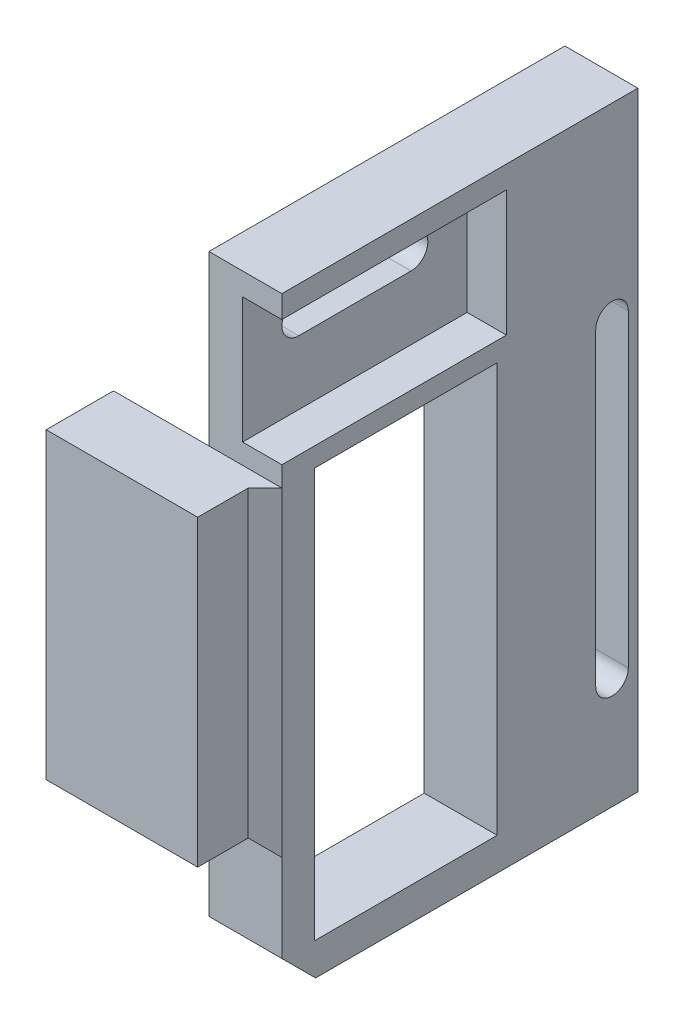
from build123d import *

# Parameters (mm, degrees)
SKETCH_1_W               = 27.1
SKETCH_1_H               = 42.3
SKETCH_1_W_2             = 21.1
SKETCH_1_H_2             = 36.3
EXTRUDE_1_DEPTH          = 6.5
CHAMFER_1_SIZE           = 3
EXTRUDE_2_DEPTH          = 8.7
EXTRUDE_2_DEPTH_BACK     = 6.5
SKETCH_2_W               = 5
SKETCH_2_H               = 24.3
SKETCH_2_R               = 1.475
SKETCH_3_W               = 27.1
SKETCH_3_H               = 15
EXTRUDE_3_DEPTH          = 6.5
SKETCH_4_W               = 17.60784849
SKETCH_4_H               = 15
EXTRUDE_4_DEPTH          = 6.5
SKETCH_5_W               = 20
SKETCH_5_H               = 11
SKETCH_5_W_2             = 5
SKETCH_5_H_2             = 36.3
EXTRUDE_5_DEPTH          = 6.5
CUT_EXTRUDE_5_DEPTH      = 47.31872216
CUT_EXTRUDE_5_DEPTH_BACK = 47.31872216
SKETCH_6_W               = 20
SKETCH_6_H               = 11.2
CUT_EXTRUDE_6_DEPTH      = 48.966384297
CUT_EXTRUDE_6_DEPTH_BACK = 48.966384297
SKETCH_9_W               = 5
SKETCH_9_H               = 24.3
SKETCH_10_W              = 20
SKETCH_10_H              = 11.2
EXTRUDE_6_DEPTH          = 3
CUT_EXTRUDE_7_DEPTH      = 46.956327339
CUT_EXTRUDE_7_DEPTH_BACK = 46.956327339
SKETCH_11_W              = 13
SKETCH_11_H              = 15
EXTRUDE_7_DEPTH          = 8.5
EXTRUDE_7_DEPTH_BACK     = 5
SKETCH_13_W              = 6
SKETCH_13_H              = 27
CHAMFER_2_SIZE           = 1.5
SKETCH_14_W              = 16.26
SKETCH_14_H              = 36.46
SKETCH_14_W_2            = 16.1
SKETCH_14_H_2            = 36.3
CUT_EXTRUDE_8_DEPTH      = 40.412878606
SKETCH_15_W              = 7.60784849
SKETCH_15_H              = 39.3
EXTRUDE_8_DEPTH          = 6
CUT_EXTRUDE_9_DEPTH      = 6
EXTRUDE_9_DEPTH          = 0.5
CUT_EXTRUDE_10_DEPTH     = 40.412878606
CUT_EXTRUDE_11_DEPTH     = 10


with BuildPart() as part:
    # 草图1 → 凸台-拉伸1 (new body)
    with BuildSketch(Plane(origin=(0, 0, 0), x_dir=(0, 0, -1), z_dir=(1, 0, 0))):
        Rectangle(SKETCH_1_W, SKETCH_1_H)
        Rectangle(SKETCH_1_W_2, SKETCH_1_H_2, mode=Mode.SUBTRACT)
    extrude(amount=EXTRUDE_1_DEPTH)

    # 倒角1
    chamfer_1_edges = [part.edges().sort_by_distance(p)[0] for p in [
        (3.25, 21.15, 13.55),
        (3.25, 21.15, -13.55),
        (3.25, -21.15, -13.55),
        (3.25, -21.15, 13.55),
    ]]
    chamfer(chamfer_1_edges, length=CHAMFER_1_SIZE)

    # 草图2 → 凸台-拉伸2 (add, two sides: drawn at the far end of the back side and taken through both)
    with BuildSketch(Plane.ZY.offset(-EXTRUDE_2_DEPTH_BACK)):
        with Locations((16.05, 0)):
            Rectangle(SKETCH_2_W, SKETCH_2_H)
        with Locations((16.05, 7.15)):
            Circle(SKETCH_2_R, mode=Mode.SUBTRACT)
        with Locations((16.05, -7.15)):
            Circle(SKETCH_2_R, mode=Mode.SUBTRACT)
    extrude(amount=EXTRUDE_2_DEPTH + EXTRUDE_2_DEPTH_BACK)

    # 草图3 → 凸台-拉伸3 (add)
    with BuildSketch(Plane(origin=(6.5, 0, 0), x_dir=(0, 0, -1), z_dir=(1, 0, 0))):
        with Locations((0, 25.65)):
            Rectangle(SKETCH_3_W, SKETCH_3_H)
    extrude(amount=-EXTRUDE_3_DEPTH)

    # 草图4 → 凸台-拉伸4 (add)
    with BuildSketch(Plane.ZY):
        with Locations((-22.353924245, 25.65)):
            Rectangle(SKETCH_4_W, SKETCH_4_H)
    extrude(amount=-EXTRUDE_4_DEPTH)

    # 草图5 → 凸台-拉伸5 (add)
    with BuildSketch(Plane.ZY):
        with Locations((3.55, 25.714062057)):
            Rectangle(SKETCH_5_W, SKETCH_5_H)
        with Locations((-8.05, 0)):
            Rectangle(SKETCH_5_W_2, SKETCH_5_H_2)
    extrude(amount=-EXTRUDE_5_DEPTH)

    # 草图6 → 切除-拉伸5 (cut, two sides: drawn at the far end of the back side and taken through both)
    with BuildSketch(Plane.ZY.offset(-CUT_EXTRUDE_5_DEPTH_BACK)):
        with Locations((3.55, 25.55)):
            Rectangle(SKETCH_6_W, SKETCH_6_H)
    extrude(amount=CUT_EXTRUDE_5_DEPTH + CUT_EXTRUDE_5_DEPTH_BACK, mode=Mode.SUBTRACT)

    # 草图9 → 切除-拉伸6 (cut, two sides: drawn at the far end of the back side and taken through both)
    with BuildSketch(Plane.ZY.offset(8.7).offset(-CUT_EXTRUDE_6_DEPTH_BACK)):
        with Locations((16.05, 0)):
            Rectangle(SKETCH_9_W, SKETCH_9_H)
    extrude(amount=CUT_EXTRUDE_6_DEPTH + CUT_EXTRUDE_6_DEPTH_BACK, mode=Mode.SUBTRACT)

    # 草图10 → 凸台-拉伸6 (add)
    with BuildSketch(Plane.ZY):
        with Locations((3.55, 25.55)):
            Rectangle(SKETCH_10_W, SKETCH_10_H)
    extrude(amount=-EXTRUDE_6_DEPTH)

    # 草图11 → 切除-拉伸7 (cut, two sides: drawn at the far end of the back side and taken through both)
    with BuildSketch(Plane(origin=(6.5, 0, 0), x_dir=(0, 0, -1), z_dir=(1, 0, 0)).offset(-CUT_EXTRUDE_7_DEPTH_BACK)):
        with Locations((24.65784849, 25.65)):
            Rectangle(SKETCH_11_W, SKETCH_11_H)
    extrude(amount=CUT_EXTRUDE_7_DEPTH + CUT_EXTRUDE_7_DEPTH_BACK, mode=Mode.SUBTRACT)

    # 草图13 → 凸台-拉伸7 (add, two sides: drawn at the far end of the back side and taken through both)
    with BuildSketch(Plane.ZY.offset(-EXTRUDE_7_DEPTH_BACK)):
        with Locations((16.55, 4.65)):
            Rectangle(SKETCH_13_W, SKETCH_13_H)
    extrude(amount=EXTRUDE_7_DEPTH + EXTRUDE_7_DEPTH_BACK)

    # 倒角2
    chamfer_2_edges = [part.edges().sort_by_distance(p)[0] for p in [
        (5, 4.65, 13.55),
        (2.5, -8.85, 13.55),
    ]]
    chamfer(chamfer_2_edges, length=CHAMFER_2_SIZE - 0.0001)  # a hair under: the kernel refuses the full size

    # 草图14 → 切除-拉伸8 (cut, through all)
    with BuildSketch(Plane.ZY):
        with Locations((2.5, 0)):
            Rectangle(SKETCH_14_W, SKETCH_14_H)
        with Locations((2.5, 0)):
            Rectangle(SKETCH_14_W_2, SKETCH_14_H_2, mode=Mode.SUBTRACT)
    extrude(amount=-CUT_EXTRUDE_8_DEPTH, mode=Mode.SUBTRACT)

    # 草图15 → 凸台-拉伸8 (add)
    with BuildSketch(Plane(origin=(6.5, 0, 0), x_dir=(0, 0, -1), z_dir=(1, 0, 0))):
        with Locations((14.353924245, -1.5)):
            Rectangle(SKETCH_15_W, SKETCH_15_H)
    extrude(amount=-EXTRUDE_8_DEPTH)

    # 草图16 → 切除-拉伸9 (cut)
    with BuildSketch(Plane(origin=(3, 0, 0), x_dir=(0, 0, -1), z_dir=(1, 0, 0))):
        with BuildLine():
            Line((-8.55, 28.65), (1.45, 28.65))
            ThreePointArc((1.45, 28.65), (2.95, 27.15), (1.45, 25.65))
            Line((1.45, 25.65), (-8.55, 25.65))
            ThreePointArc((-8.55, 25.65), (-10.05, 27.15), (-8.55, 28.65))
        make_face()
    extrude(amount=-CUT_EXTRUDE_9_DEPTH, mode=Mode.SUBTRACT)

    # 草图17 → 凸台-拉伸9 (add)
    with BuildSketch(Plane.ZY.offset(-0.5)):
        Polygon((-13.55, -18.15), (-13.55, 18.15), (-18.15784849, 18.15), (-18.15784849, -21.15), (-10.55, -21.15), align=None)
    extrude(amount=EXTRUDE_9_DEPTH)

    # 草图18 → 切除-拉伸10 (cut, through all)
    with BuildSketch(Plane.ZY):
        with BuildLine():
            Line((-14.40784849, 11.85), (-14.40784849, -11.15))
            ThreePointArc((-14.40784849, -11.15), (-15.85784849, -12.6), (-17.30784849, -11.15))
            Line((-17.30784849, -11.15), (-17.30784849, 11.85))
            ThreePointArc((-17.30784849, 11.85), (-15.85784849, 13.3), (-14.40784849, 11.85))
        make_face()
    extrude(amount=-CUT_EXTRUDE_10_DEPTH, mode=Mode.SUBTRACT)

    # 草图19 → 切除-拉伸11 (cut)
    with BuildSketch(Plane(origin=(6.5, 0, 0), x_dir=(0, 0, -1), z_dir=(1, 0, 0))):
        with BuildLine():
            Line((14.40784849, 11.85), (17.30784849, 11.85))
            Line((17.30784849, 11.85), (17.30784849, 16.4))
            ThreePointArc((17.30784849, 16.4), (15.85784849, 17.85), (14.40784849, 16.4))
            Line((14.40784849, 16.4), (14.40784849, 11.85))
        make_face()
    extrude(amount=-CUT_EXTRUDE_11_DEPTH, mode=Mode.SUBTRACT)


solid = part.part
